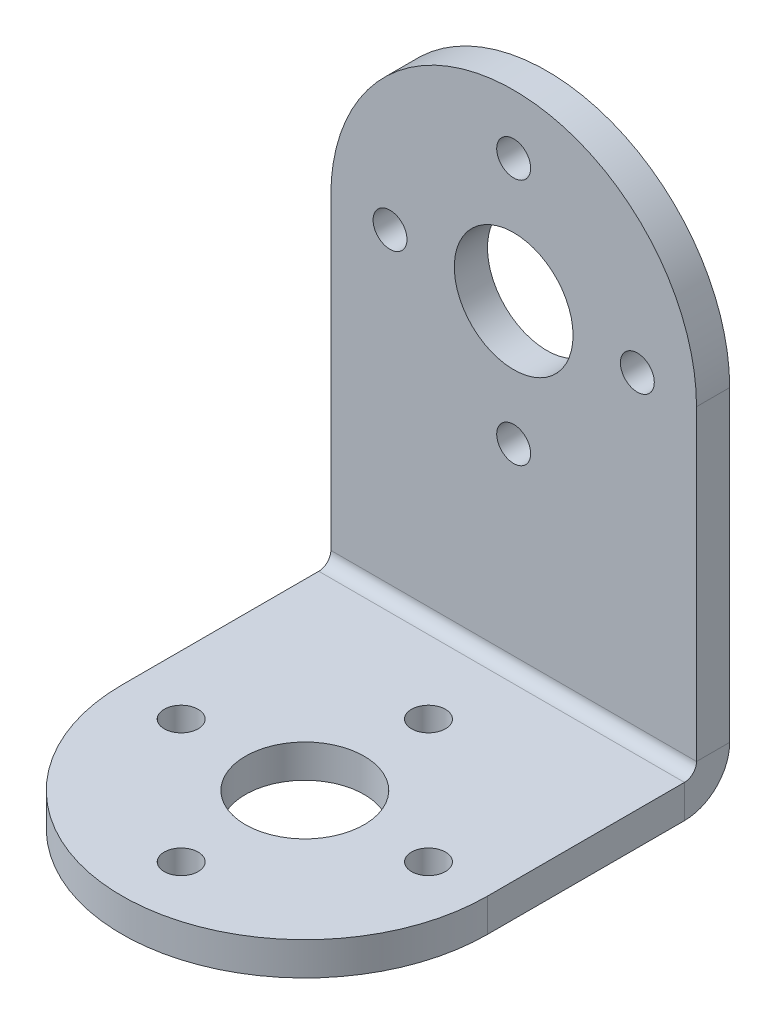
from build123d import *

# Parameters (mm, degrees)
BASE_FLANGE1_DEPTH = 12.319
FILLET1_RADIUS     = 12.319
FILLET1_LENGTH     = 2.2352
FILLET2_RADIUS     = 12.319
FILLET2_LENGTH     = 2.2352
SKETCH3_R          = 4.0005
SKETCH3_R_2        = 1.143
EXTRUDE1_DEPTH     = 2.2352
SKETCH5_R          = 4.0005
SKETCH5_R_2        = 1.143
EXTRUDE2_DEPTH     = 2.2352


# Sheet-metal steps are written as plain solids
with BuildPart() as part:
    # Sketch1 → Base-Flange1 (new, symmetric)
    with BuildSketch(Plane(origin=(0, 0, 0), x_dir=(0, 0, -1), z_dir=(1, 0, 0))):
        with BuildLine():
            Line((-28.6258, 0), (-3.048, 0))
            ThreePointArc((-3.048, 0), (-0.892738531, 0.892738531), (0, 3.048))
            Line((0, 3.048), (0, 36.068))
            Line((0, 36.068), (-2.2352, 36.068))
            Line((-2.2352, 36.068), (-2.2352, 3.048))
            ThreePointArc((-2.2352, 3.048), (-2.473263608, 2.473263608), (-3.048, 2.2352))
            Line((-3.048, 2.2352), (-28.6258, 2.2352))
            Line((-28.6258, 2.2352), (-28.6258, 0))
        make_face()
    extrude(amount=BASE_FLANGE1_DEPTH, both=True)

    # Fillet1: full round fillet: the end face becomes a half cylinder, R = half its width
    fillet1_face = Plane((0, 36.068, 1.1176), x_dir=(0, 0, -1), z_dir=(0, 1, 0))  # on the end face: x along it, z out of the body
    fillet1_slab = fillet1_face.offset(-FILLET1_RADIUS / 2) * Box(FILLET1_LENGTH, 2 * FILLET1_RADIUS, FILLET1_RADIUS, mode=Mode.PRIVATE)  # the body's end, R deep
    fillet1_round = Plane((0, 23.749, 1.1176), x_dir=(0, 1, 0), z_dir=(0, 0, -1)) * Cylinder(FILLET1_RADIUS, FILLET1_LENGTH, mode=Mode.PRIVATE)  # its axis R under the face
    add(fillet1_slab - fillet1_round, mode=Mode.SUBTRACT)

    # Fillet2: full round fillet: the end face becomes a half cylinder, R = half its width
    fillet2_face = Plane((0, 1.1176, 28.6258), x_dir=(0, 1, 0), z_dir=(0, 0, 1))  # on the end face: x along it, z out of the body
    fillet2_slab = fillet2_face.offset(-FILLET2_RADIUS / 2) * Box(FILLET2_LENGTH, 2 * FILLET2_RADIUS, FILLET2_RADIUS, mode=Mode.PRIVATE)  # the body's end, R deep
    fillet2_round = Plane((0, 1.1176, 16.3068), x_dir=(0, 0, 1), z_dir=(0, 1, 0)) * Cylinder(FILLET2_RADIUS, FILLET2_LENGTH, mode=Mode.PRIVATE)  # its axis R under the face
    add(fillet2_slab - fillet2_round, mode=Mode.SUBTRACT)

    # Sketch3 → Extrude1 (cut)
    with BuildSketch(Plane.XY.offset(2.2352)):
        with Locations((0, 23.749)):
            Circle(SKETCH3_R)
        with Locations((0, 32.0802)):
            Circle(SKETCH3_R_2)
        with Locations((8.3312, 23.749)):
            Circle(SKETCH3_R_2)
        with Locations((0, 15.4178)):
            Circle(SKETCH3_R_2)
        with Locations((-8.3312, 23.749)):
            Circle(SKETCH3_R_2)
    extrude(amount=-EXTRUDE1_DEPTH, mode=Mode.SUBTRACT)

    # Sketch5 → Extrude2 (cut)
    with BuildSketch(Plane(origin=(0, 2.2352, 0), x_dir=(1, 0, 0), z_dir=(0, 1, 0))):
        with Locations(Location((0, -16.3068, 0), (0, 0, 270))):
            Circle(SKETCH5_R)
        with Locations(Location((0, -7.9756, 0), (0, 0, 270))):
            Circle(SKETCH5_R_2)
        with Locations(Location((8.3312, -16.3068, 0), (0, 0, 270))):
            Circle(SKETCH5_R_2)
        with Locations(Location((0, -24.638, 0), (0, 0, 270))):
            Circle(SKETCH5_R_2)
        with Locations(Location((-8.3312, -16.3068, 0), (0, 0, 270))):
            Circle(SKETCH5_R_2)
    extrude(amount=-EXTRUDE2_DEPTH, mode=Mode.SUBTRACT)


solid = part.part
